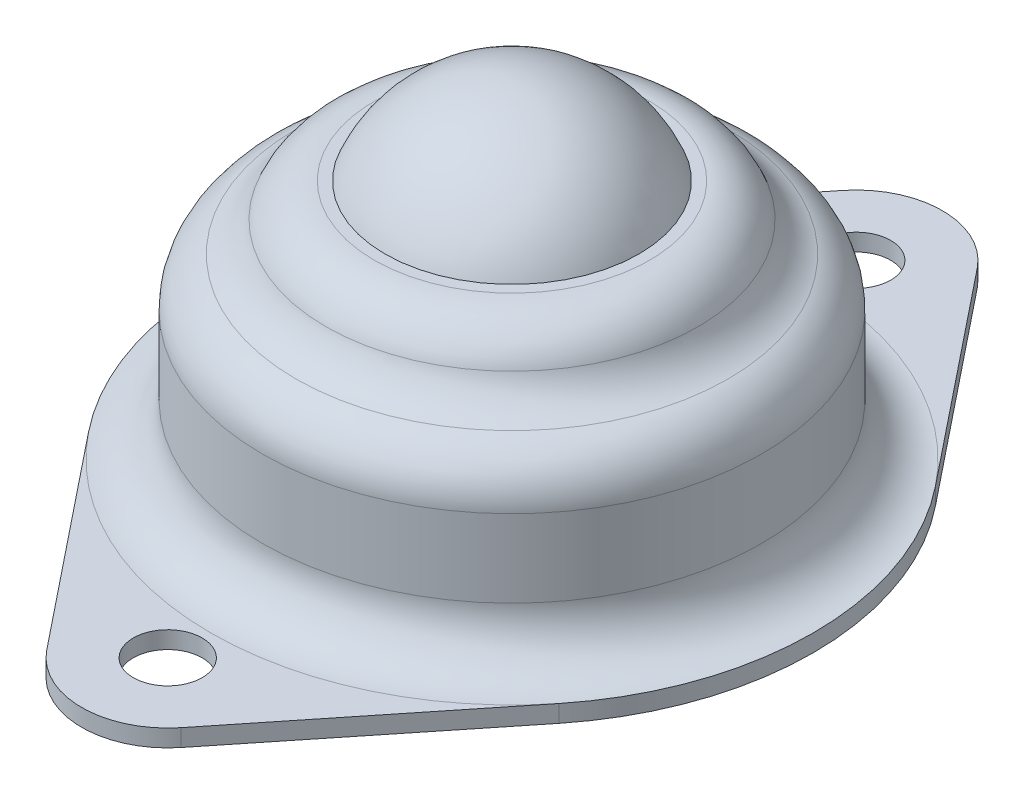
from build123d import *

# Parameters (mm, degrees)
SKETCH_1_R      = 2
EXTRUDE_1_DEPTH = 1
FILLET_1_R      = 3


with BuildPart() as part:
    # 草图1 → 凸台-拉伸1 (new body)
    with BuildSketch(Plane(origin=(0, 0, 0), x_dir=(1, 0, 0), z_dir=(0, 1, 0))):
        with BuildLine():
            Line((-3.903123749, 23.125), (-13.660933121, 10.9375))
            ThreePointArc((-13.660933121, 10.9375), (-17.5, 0), (-13.660933121, -10.9375))
            Line((-13.660933121, -10.9375), (-3.903123749, -23.125))
            ThreePointArc((-3.903123749, -23.125), (0, -25), (3.903123749, -23.125))
            Line((3.903123749, -23.125), (13.660933121, -10.9375))
            ThreePointArc((13.660933121, -10.9375), (17.5, 0), (13.660933121, 10.9375))
            Line((13.660933121, 10.9375), (3.903123749, 23.125))
            ThreePointArc((3.903123749, 23.125), (0, 25), (-3.903123749, 23.125))
        make_face()
        with Locations(Location((0, 20, 0), (0, 0, 270))):
            Circle(SKETCH_1_R, mode=Mode.SUBTRACT)
        with Locations(Location((0, -20, 0), (0, 0, 90))):
            Circle(SKETCH_1_R, mode=Mode.SUBTRACT)
    extrude(amount=EXTRUDE_1_DEPTH)

    # 草图3 → 旋转2 (revolve)
    with BuildSketch(Plane(origin=(0, 0, 0), x_dir=(0, 0, -1), z_dir=(1, 0, 0))):
        with BuildLine():
            Line((-14.5, 8.5), (-14.5, 1))
            Line((-14.5, 1), (0, 1))
            Line((0, 1), (0, 4.12))
            ThreePointArc((0, 4.12), (-6.572183808, 7.604666118), (-7.375635566, 15))
            Line((-7.375635566, 15), (-8, 15))
            ThreePointArc((-8, 15), (-9.706991606, 14.467018374), (-10.807453104, 13.057453104))
            ThreePointArc((-10.807453104, 13.057453104), (-11.493585865, 11.993585865), (-12.557453104, 11.307453104))
            ThreePointArc((-12.557453104, 11.307453104), (-13.967018374, 10.206991606), (-14.5, 8.5))
        make_face()
        with BuildLine():
            ThreePointArc((-7.375635566, 15), (-6.572183808, 7.604666118), (0, 4.12))
            Line((0, 4.12), (0, 15))
            Line((0, 15), (-7.375635566, 15))
        make_face()
        with BuildLine():
            Line((-7.375635566, 15), (0, 15))
            Line((0, 15), (0, 20))
            ThreePointArc((0, 20), (-4.455333882, 18.632183808), (-7.375635566, 15))
        make_face()
    revolve(axis=Axis((0, 15, 0), (0, -1, 0)))

    # 圆角1
    fillet_1_edges = [part.edges().sort_by_distance(p)[0] for p in [
        (0, 1, -14.5),
    ]]
    fillet(fillet_1_edges, radius=FILLET_1_R - 0.0001)  # a hair under: the kernel refuses the full size


solid = part.part
